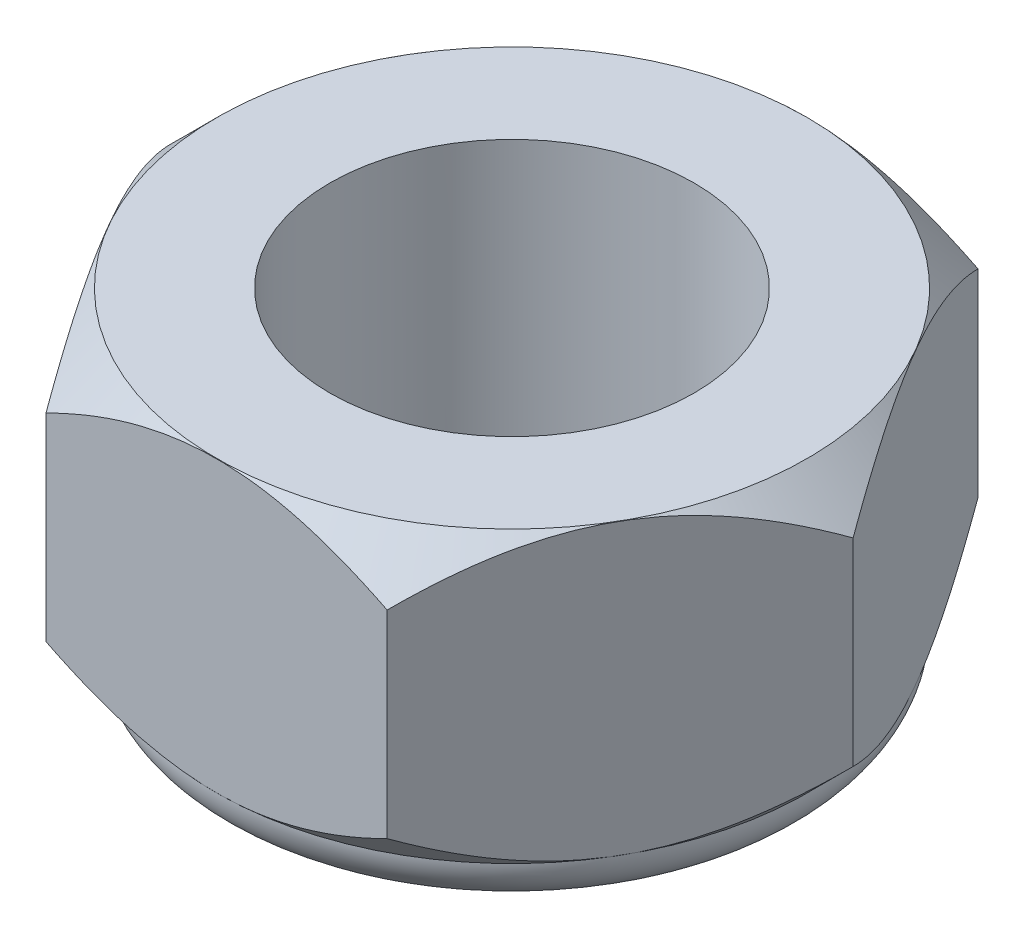
from build123d import *

# Parameters (mm, degrees)
SKETCH1_R                    = 3.5
BOSS_EXTRUDE1_DEPTH          = 6.3
F_5_16_24_TAPPED_HOLE4_D     = 7.919999908
F_5_16_24_TAPPED_HOLE4_DEPTH = 12
F_5_16_24_TAPPED_HOLE4_TIP   = 2.379408024
SKETCH27_R                   = 6.421961615
SKETCH27_R_2                 = 3.97
BOSS_EXTRUDE2_DEPTH          = 1
FILLET2_R                    = 1
FILLET3_R                    = 0.5


with BuildPart() as part:
    # Sketch1 → Boss-Extrude1 (new body)
    with BuildSketch(Plane(origin=(0, 0, 0), x_dir=(1, 0, 0), z_dir=(0, 1, 0))):
        Polygon((3.70947548, -6.425), (7.418950959, 0), (3.70947548, 6.425), (-3.70947548, 6.425), (-7.418950959, 0), (-3.70947548, -6.425), align=None)
        with Locations(Location((0, 0, 0), (0, 0, 270))):
            Circle(SKETCH1_R, mode=Mode.SUBTRACT)
    extrude(amount=BOSS_EXTRUDE1_DEPTH)

    # Sketch3 → Cut-Revolve4 (revolve, cut)
    with BuildSketch(Plane.XY, mode=Mode.PRIVATE) as cut_revolve4_sk:
        Polygon((-6.421961615, 6.8), (-6.421961615, 6.3), (-7.421961615, 5.3), (-7.921961615, 5.3), (-7.921961615, 6.8), align=None)
        Polygon((-7.421961615, 1), (-6.421961615, 0), (-6.421961615, -0.5), (-7.921961615, -0.5), (-7.921961615, 1), align=None)
    revolve(cut_revolve4_sk.sketch.rotate(Axis((0, 0, 0), (0, 1, 0)), 120.000000074), axis=Axis((0, 0, 0), (0, 1, 0)), mode=Mode.SUBTRACT)

    # 5/16-24 Tapped Hole4
    with Locations(Plane.XZ):
        with Locations((0, 0)):
            Hole(F_5_16_24_TAPPED_HOLE4_D / 2, depth=F_5_16_24_TAPPED_HOLE4_DEPTH)
            with Locations((0, 0, -(F_5_16_24_TAPPED_HOLE4_DEPTH + F_5_16_24_TAPPED_HOLE4_TIP / 2))):  # 118° drill point
                Cone(0, F_5_16_24_TAPPED_HOLE4_D / 2, F_5_16_24_TAPPED_HOLE4_TIP, mode=Mode.SUBTRACT)

    # Sketch27 → Boss-Extrude2 (add)
    with BuildSketch(Plane.XZ):
        with Locations(Location((0, 0, 0), (0, 0, 270))):
            Circle(SKETCH27_R)
        with Locations(Location((0, 0, 0), (0, 0, 270))):
            Circle(SKETCH27_R_2, mode=Mode.SUBTRACT)
    extrude(amount=BOSS_EXTRUDE2_DEPTH)

    # Fillet2
    fillet2_edges = [part.edges().sort_by_distance(p)[0] for p in [
        (0, -1, 6.421961615),
    ]]
    fillet(fillet2_edges, radius=FILLET2_R - 0.0001)  # a hair under: the kernel refuses the full size

    # Fillet3
    fillet3_edges = [part.edges().sort_by_distance(p)[0] for p in [
        (0, -1, 3.97),
    ]]
    fillet(fillet3_edges, radius=FILLET3_R)


solid = part.part
